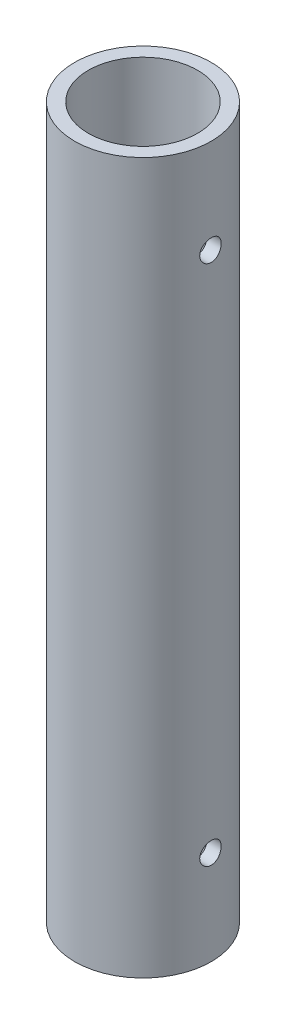
from build123d import *

# Parameters (mm, degrees)
SKETCH1_R           = 15.875
SKETCH1_R_2         = 12.7
BOSS_EXTRUDE1_DEPTH = 82.55
SKETCH2_R           = 2.4892
CUT_EXTRUDE1_DEPTH  = 86.548429267


with BuildPart() as part:
    # Sketch1 → Boss-Extrude1 (new, symmetric)
    with BuildSketch(Plane(origin=(0, 0, 0), x_dir=(1, 0, 0), z_dir=(0, 1, 0))):
        Circle(SKETCH1_R)
        Circle(SKETCH1_R_2, mode=Mode.SUBTRACT)
    extrude(amount=BOSS_EXTRUDE1_DEPTH, both=True)

    # Sketch2 → Cut-Extrude1 (cut, symmetric)
    with BuildSketch(Plane(origin=(0, 0, 0), x_dir=(0, 0, -1), z_dir=(1, 0, 0))):
        with Locations((0, 60.6425)):
            Circle(SKETCH2_R)
    cut_extrude1 = extrude(amount=CUT_EXTRUDE1_DEPTH, both=True, mode=Mode.SUBTRACT)

    # Mirror1: Cut-Extrude1 across plane
    add(cut_extrude1.mirror(Plane.ZX), mode=Mode.SUBTRACT)


solid = part.part
